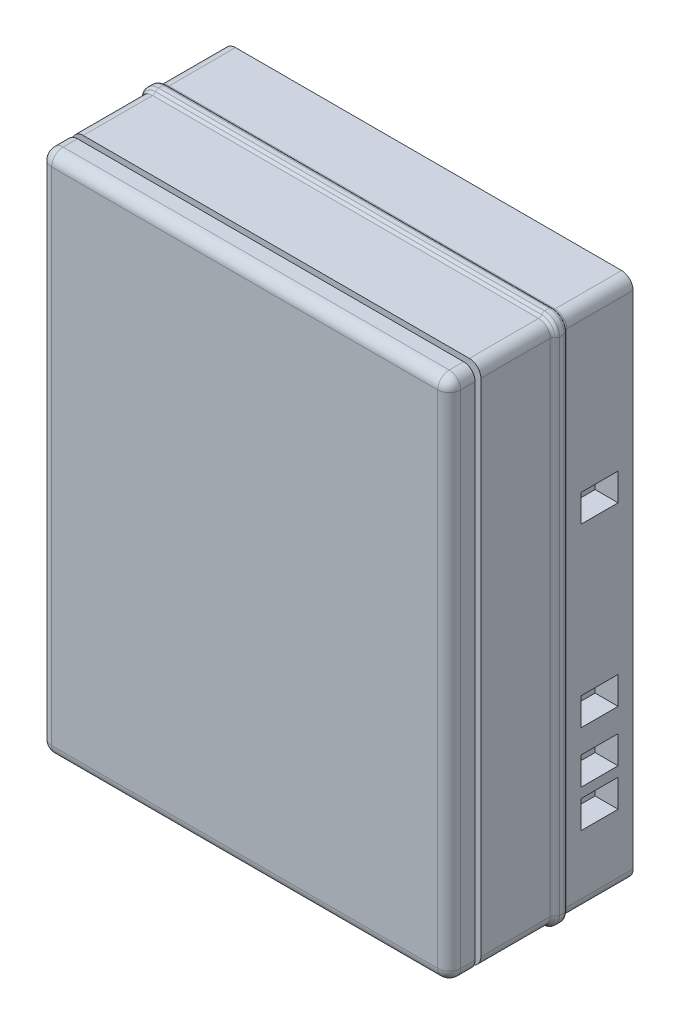
from build123d import *

# Parameters (mm, degrees)
CROQUIS1_W                   = 356
CROQUIS1_H                   = 456
SALIENTE_EXTRUIR1_DEPTH      = 160
REDONDEO1_R                  = 10
CORTAR_EXTRUIR1_DEPTH        = 2.5
CORTAR_EXTRUIR1_DEPTH_BACK   = 2.5
CORTAR_EXTRUIR1_START        = -25
CROQUIS2_W                   = 356
CROQUIS2_H                   = 456
CROQUIS2_W_2                 = 336
CROQUIS2_H_2                 = 436
REDONDEO2_R                  = 10
SALIENTE_EXTRUIR2_DEPTH      = 5
SALIENTE_EXTRUIR2_DEPTH_BACK = 5
REDONDEO6_R                  = 3
REDONDEO7_R                  = 3
REDONDEO8_R                  = 3
CROQUIS5_W                   = 32.5
CROQUIS5_H                   = 24.2
CROQUIS5_H_2                 = 24.275971101
CROQUIS5_H_3                 = 24.099571128
CROQUIS5_H_4                 = 23.966296081
CORTAR_EXTRUIR2_DEPTH        = 20


# Some blends are built 0.0001 mm under size
with BuildPart() as part:
    # Croquis1 → Saliente-Extruir1 (new body)
    with BuildSketch(Plane.XY):
        Rectangle(CROQUIS1_W, CROQUIS1_H)
    extrude(amount=SALIENTE_EXTRUIR1_DEPTH)

    # Redondeo1
    redondeo1_edges = [part.edges().sort_by_distance(p)[0] for p in [
        (-178, 0, 160),
        (0, -228, 160),
        (178, 0, 160),
        (178, -228, 80),
        (-178, -228, 80),
        (-178, 228, 80),
        (178, 228, 80),
        (0, 228, 160),
    ]]
    fillet(redondeo1_edges, radius=REDONDEO1_R)

    # Croquis2 → Cortar-Extruir1 (cut, two sides: drawn at the far end of the back side and taken through both)
    with BuildSketch(Plane.XY.offset(160).offset(CORTAR_EXTRUIR1_START - CORTAR_EXTRUIR1_DEPTH_BACK)):
        Rectangle(CROQUIS2_W, CROQUIS2_H)
        Rectangle(CROQUIS2_W_2, CROQUIS2_H_2, mode=Mode.SUBTRACT)
    extrude(amount=CORTAR_EXTRUIR1_DEPTH + CORTAR_EXTRUIR1_DEPTH_BACK, mode=Mode.SUBTRACT)

    # Redondeo2
    redondeo2_edges = [part.edges().sort_by_distance(p)[0] for p in [
        (168, 218, 135),
        (-168, 218, 135),
        (-168, -218, 135),
        (168, -218, 135),
    ]]
    fillet(redondeo2_edges, radius=REDONDEO2_R)

    # Croquis4 → Saliente-Extruir2 (add, two sides: drawn at the far end of the back side and taken through both)
    with BuildSketch(Plane.XY.offset(65).offset(-SALIENTE_EXTRUIR2_DEPTH_BACK)):
        with BuildLine():
            Line((168, -231), (-168, -231))
            ThreePointArc((-168, -231), (-177.192388155, -227.192388155), (-181, -218))
            Line((-181, -218), (-181, 218))
            ThreePointArc((-181, 218), (-177.192388155, 227.192388155), (-168, 231))
            Line((-168, 231), (168, 231))
            ThreePointArc((168, 231), (177.192388155, 227.192388155), (181, 218))
            Line((181, 218), (181, -218))
            ThreePointArc((181, -218), (177.192388155, -227.192388155), (168, -231))
        make_face()
    extrude(amount=SALIENTE_EXTRUIR2_DEPTH + SALIENTE_EXTRUIR2_DEPTH_BACK)

    # Redondeo6
    redondeo6_edges = [part.edges().sort_by_distance(p)[0] for p in [
        (-177.192388155, 227.192388155, 70),
        (-181, 0, 70),
        (-177.192388155, -227.192388155, 70),
        (0, -231, 70),
        (177.192388155, -227.192388155, 70),
        (181, 0, 70),
        (177.192388155, 227.192388155, 70),
        (0, 231, 70),
        (-177.192388155, 227.192388155, 60),
        (0, 231, 60),
        (177.192388155, 227.192388155, 60),
        (181, 0, 60),
        (177.192388155, -227.192388155, 60),
        (0, -231, 60),
        (-177.192388155, -227.192388155, 60),
        (-181, 0, 60),
    ]]
    fillet(redondeo6_edges, radius=REDONDEO6_R - 0.0001)  # a hair under: the kernel refuses the full size

    # Redondeo7
    # the kernel refuses this fillet: 3 mm, written as the material it adds along each edge
    with BuildSketch(Plane(origin=(178, 218, 60), x_dir=(0.9659313848535178, 0, 0.25879829936644666), z_dir=(0, -1, 0)), Plane(origin=(-178, -218, 60), x_dir=(-0.9659313848535145, 0, 0.25879829936645976), z_dir=(0, 1, 0))) as redondeo7_piece_1:
        with BuildLine():
            CenterArc((2.329422704, -2.897768274), REDONDEO7_R, 105.000679234, 60.000551337)
            Line((-0.56837145, -2.121373376), (-0.858150866, -2.043733886))
            Line((-0.858150866, -2.043733886), (-0.289779415, 0.07763949))
            Line((-0.289779415, 0.07763949), (0.07763949, 0.289779415))
            ThreePointArc((0.07763949, 0.289779415), (0.077736083, 0.289753536), (1.475282068, 0.289776827))
            Line((1.475282068, 0.289776827), (1.552931216, 0))
        make_face()
    extrude(amount=436)
    with BuildSketch(Plane(origin=(-168, -218, 60), x_dir=(-1, 0, 0), z_dir=(0, 1, 0))) as redondeo7_piece_2:
        with BuildLine():
            CenterArc((13, -2.196194687), REDONDEO7_R, 119.999448663, 60.000551337)
            Line((10, -2.196194687), (9.7, -2.196194687))
            Line((9.7, -2.196194687), (9.7, 0))
            Line((9.7, 0), (10, 0.3))
            ThreePointArc((10, 0.3), (10.0001, 0.3), (11.3500275, 0.661705022))
            Line((11.3500275, 0.661705022), (11.500025, 0.401895958))
        make_face()
    revolve(axis=Axis((-168, -218, 60), (0, 0, 1)), revolution_arc=90)
    with BuildSketch(Plane(origin=(168, -218, 60), x_dir=(0, -1, 0), z_dir=(-1, 0, 0))) as redondeo7_piece_3:
        with BuildLine():
            CenterArc((13, -2.196194687), REDONDEO7_R, 119.999448663, 60.000551337)
            Line((10, -2.196194687), (9.7, -2.196194687))
            Line((9.7, -2.196194687), (9.7, 0))
            Line((9.7, 0), (10, 0.3))
            ThreePointArc((10, 0.3), (10.0001, 0.3), (11.3500275, 0.661705022))
            Line((11.3500275, 0.661705022), (11.500025, 0.401895958))
        make_face()
    revolve(axis=Axis((168, -218, 60), (0, 0, 1)), revolution_arc=90)
    with BuildSketch(Plane(origin=(168, 218, 60), x_dir=(1, 0, 0), z_dir=(0, -1, 0))) as redondeo7_piece_4:
        with BuildLine():
            CenterArc((13, -2.196194687), REDONDEO7_R, 119.999448663, 60.000551337)
            Line((10, -2.196194687), (9.7, -2.196194687))
            Line((9.7, -2.196194687), (9.7, 0))
            Line((9.7, 0), (10, 0.3))
            ThreePointArc((10, 0.3), (10.0001, 0.3), (11.3500275, 0.661705022))
            Line((11.3500275, 0.661705022), (11.500025, 0.401895958))
        make_face()
    revolve(axis=Axis((168, 218, 60), (0, 0, 1)), revolution_arc=90)
    with BuildSketch(Plane(origin=(-168, 218, 60), x_dir=(0, 1, 0), z_dir=(1, 0, 0))) as redondeo7_piece_5:
        with BuildLine():
            CenterArc((13, -2.196194687), REDONDEO7_R, 119.999448663, 60.000551337)
            Line((10, -2.196194687), (9.7, -2.196194687))
            Line((9.7, -2.196194687), (9.7, 0))
            Line((9.7, 0), (10, 0.3))
            ThreePointArc((10, 0.3), (10.0001, 0.3), (11.3500275, 0.661705022))
            Line((11.3500275, 0.661705022), (11.500025, 0.401895958))
        make_face()
    revolve(axis=Axis((-168, 218, 60), (0, 0, 1)), revolution_arc=90)
    with BuildSketch(Plane(origin=(-168, 228, 60), x_dir=(0, 0.9659313848535145, 0.25879829936645976), z_dir=(1, 0, 0)), Plane(origin=(168, -228, 60), x_dir=(0, -0.9659313848535215, 0.2587982993664339), z_dir=(-1, 0, 0))) as redondeo7_piece_6:
        with BuildLine():
            CenterArc((2.329422704, -2.897768274), REDONDEO7_R, 105.000679234, 60.000551337)
            Line((-0.56837145, -2.121373376), (-0.858150866, -2.043733886))
            Line((-0.858150866, -2.043733886), (-0.289779415, 0.07763949))
            Line((-0.289779415, 0.07763949), (0.07763949, 0.289779415))
            ThreePointArc((0.07763949, 0.289779415), (0.077736083, 0.289753536), (1.475282068, 0.289776827))
            Line((1.475282068, 0.289776827), (1.552931216, 0))
        make_face()
    extrude(amount=336)

    # Redondeo8
    # the kernel refuses this fillet: 3 mm, written as the material it adds along each edge
    with BuildSketch(Plane(origin=(178, 218, 70), x_dir=(0.965931384853519, 0, -0.2587982993664427), z_dir=(0, -1, 0)), Plane(origin=(-178, -218, 70), x_dir=(-0.9659313848535145, 0, -0.25879829936645976), z_dir=(0, 1, 0))) as redondeo8_piece_1:
        with BuildLine():
            CenterArc((2.329422704, 2.897768274), REDONDEO8_R, 194.99876943, 60.000551337)
            Line((-0.56837145, 2.121373376), (-0.858150866, 2.043733886))
            Line((-0.858150866, 2.043733886), (-0.289779415, -0.07763949))
            Line((-0.289779415, -0.07763949), (0.07763949, -0.289779415))
            ThreePointArc((0.07763949, -0.289779415), (0.077736083, -0.289753536), (1.475282068, -0.289776827))
            Line((1.475282068, -0.289776827), (1.552931216, 0))
        make_face()
    extrude(amount=436)
    with BuildSketch(Plane(origin=(-168, 228, 70), x_dir=(0, 0.9659313848535145, -0.25879829936645976), z_dir=(1, 0, 0)), Plane(origin=(168, -228, 70), x_dir=(0, -0.9659313848535178, -0.25879829936644666), z_dir=(-1, 0, 0))) as redondeo8_piece_2:
        with BuildLine():
            CenterArc((2.329422704, 2.897768274), REDONDEO8_R, 194.99876943, 60.000551337)
            Line((-0.56837145, 2.121373376), (-0.858150866, 2.043733886))
            Line((-0.858150866, 2.043733886), (-0.289779415, -0.07763949))
            Line((-0.289779415, -0.07763949), (0.07763949, -0.289779415))
            ThreePointArc((0.07763949, -0.289779415), (0.077736083, -0.289753536), (1.475282068, -0.289776827))
            Line((1.475282068, -0.289776827), (1.552931216, 0))
        make_face()
    extrude(amount=336)
    with BuildSketch(Plane(origin=(-168, -218, 70), x_dir=(-1, 0, 0), z_dir=(0, 1, 0))) as redondeo8_piece_3:
        with BuildLine():
            CenterArc((13, 2.196194687), REDONDEO8_R, 180, 60.000551337)
            Line((10, 2.196194687), (9.7, 2.196194687))
            Line((9.7, 2.196194687), (9.7, 0))
            Line((9.7, 0), (10, -0.3))
            ThreePointArc((10, -0.3), (10.0001, -0.3), (11.3500275, -0.661705022))
            Line((11.3500275, -0.661705022), (11.500025, -0.401895958))
        make_face()
    revolve(axis=Axis((-168, -218, 70), (0, 0, 1)), revolution_arc=90)
    with BuildSketch(Plane(origin=(168, -218, 70), x_dir=(0, -1, 0), z_dir=(-1, 0, 0))) as redondeo8_piece_4:
        with BuildLine():
            CenterArc((13, 2.196194687), REDONDEO8_R, 180, 60.000551337)
            Line((10, 2.196194687), (9.7, 2.196194687))
            Line((9.7, 2.196194687), (9.7, 0))
            Line((9.7, 0), (10, -0.3))
            ThreePointArc((10, -0.3), (10.0001, -0.3), (11.3500275, -0.661705022))
            Line((11.3500275, -0.661705022), (11.500025, -0.401895958))
        make_face()
    revolve(axis=Axis((168, -218, 70), (0, 0, 1)), revolution_arc=90)
    with BuildSketch(Plane(origin=(168, 218, 70), x_dir=(1, 0, 0), z_dir=(0, -1, 0))) as redondeo8_piece_5:
        with BuildLine():
            CenterArc((13, 2.196194687), REDONDEO8_R, 180, 60.000551337)
            Line((10, 2.196194687), (9.7, 2.196194687))
            Line((9.7, 2.196194687), (9.7, 0))
            Line((9.7, 0), (10, -0.3))
            ThreePointArc((10, -0.3), (10.0001, -0.3), (11.3500275, -0.661705022))
            Line((11.3500275, -0.661705022), (11.500025, -0.401895958))
        make_face()
    revolve(axis=Axis((168, 218, 70), (0, 0, 1)), revolution_arc=90)
    with BuildSketch(Plane(origin=(-168, 218, 70), x_dir=(0, 1, 0), z_dir=(1, 0, 0))) as redondeo8_piece_6:
        with BuildLine():
            CenterArc((13, 2.196194687), REDONDEO8_R, 180, 60.000551337)
            Line((10, 2.196194687), (9.7, 2.196194687))
            Line((9.7, 2.196194687), (9.7, 0))
            Line((9.7, 0), (10, -0.3))
            ThreePointArc((10, -0.3), (10.0001, -0.3), (11.3500275, -0.661705022))
            Line((11.3500275, -0.661705022), (11.500025, -0.401895958))
        make_face()
    revolve(axis=Axis((-168, 218, 70), (0, 0, 1)), revolution_arc=90)

    # Croquis5 → Cortar-Extruir2 (cut)
    with BuildSketch(Plane(origin=(178, 0, 0), x_dir=(0, 0, -1), z_dir=(1, 0, 0))):
        with Locations((-29.303847577, -154.422503433)):
            Rectangle(CROQUIS5_W, CROQUIS5_H)
        with Locations((-29.303847577, -121.606769627)):
            Rectangle(CROQUIS5_W, CROQUIS5_H_2)
        with Locations((-29.303847577, -76.907454446)):
            Rectangle(CROQUIS5_W, CROQUIS5_H_3)
        with Locations((-29.303847577, 76.415754786)):
            Rectangle(CROQUIS5_W, CROQUIS5_H_4)
    extrude(amount=-CORTAR_EXTRUIR2_DEPTH, mode=Mode.SUBTRACT)


solid = part.part
